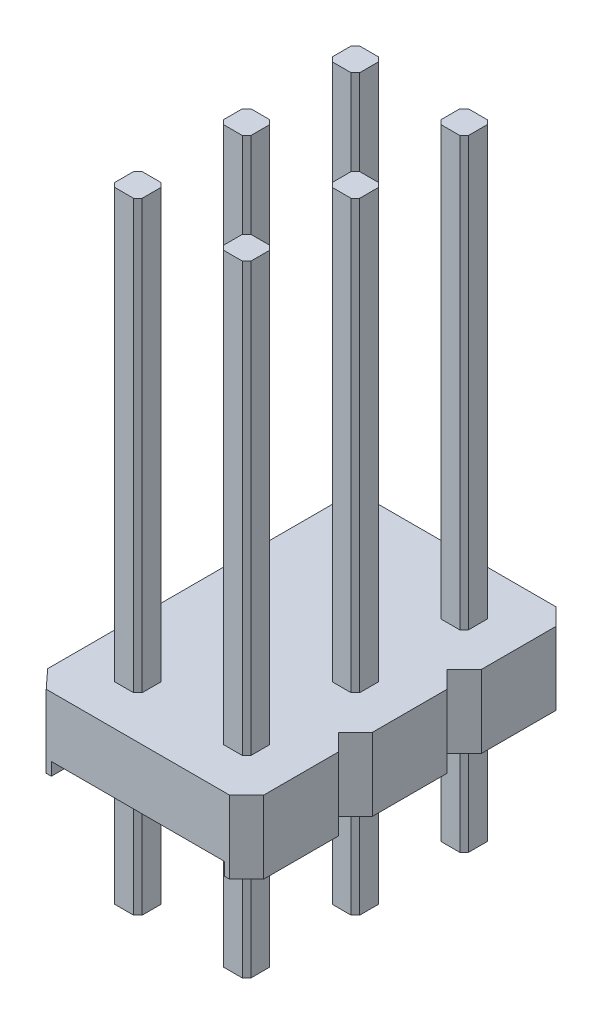
from build123d import *

# Parameters (mm, degrees)
BOSS_EXTRUDE1_DEPTH   = 1.7
SKETCH2_W             = 4.04
SKETCH2_H             = 0.3
CUT_EXTRUDE1_DEPTH    = 2.54
BOSS_EXTRUDE2_START   = -4.5
BOSS_EXTRUDE2_DEPTH   = 14.5
BOSS_EXTRUDE2_2_DEPTH = 14.5
LPATTERN3_START       = -2.8
LPATTERN3_DEPTH       = 14.5
LPATTERN3_2_DEPTH     = 14.5
LPATTERN3_3_DEPTH     = 14.5
LPATTERN3_4_DEPTH     = 14.5
LPATTERN3_START_2     = 0.3
LPATTERN3_5_DEPTH     = 1.4
LPATTERN3_6_DEPTH     = 0.3


# Read off the part's stored shape, not the designer's step: LPattern3
with BuildPart() as part:
    # Sketch1 → Boss-Extrude1 (new body)
    with BuildSketch(Plane(origin=(0, 0, 0), x_dir=(1, 0, 0), z_dir=(0, 1, 0))):
        Polygon((-2.54, 0.903421053), (-2.14, 1.27), (2.14, 1.27), (2.54, 0.87), (2.54, -0.87), (2.14, -1.27), (-2.14, -1.27), (-2.54, -0.836578947), align=None)
    extrude(amount=BOSS_EXTRUDE1_DEPTH)

    # Sketch2 → Cut-Extrude1 (cut)
    with BuildSketch(Plane.XY.offset(1.27)):
        with Locations((0, 0.15)):
            Rectangle(SKETCH2_W, SKETCH2_H)
    extrude(amount=-CUT_EXTRUDE1_DEPTH, mode=Mode.SUBTRACT)

    # LPattern3 5 outline → LPattern3 5 (add)
    with BuildSketch(Plane(origin=(0, 0, 0), x_dir=(1, 0, 0), z_dir=(0, 1, 0)).offset(LPATTERN3_START_2)):
        Polygon((-2.54, 3.443421053), (-2.54, 1.703421053), (-2.14, 1.27), (2.14, 1.27), (2.54, 1.67), (2.54, 3.41), (2.14, 3.81), (2.54, 4.21), (2.54, 5.95), (2.14, 6.35), (-2.14, 6.35), (-2.54, 5.983421053), (-2.54, 4.243421053), (-2.14, 3.81), align=None)
    extrude(amount=LPATTERN3_5_DEPTH)

    # LPattern3 6 outline → LPattern3 6 (add)
    with BuildSketch(Plane(origin=(0, 0, 0), x_dir=(1, 0, 0), z_dir=(0, 1, 0))):
        Polygon((-2.54, 3.443421053), (-2.54, 1.703421053), (-2.14, 1.27), (-2.02, 1.27), (-2.02, 6.35), (-2.14, 6.35), (-2.54, 5.983421053), (-2.54, 4.243421053), (-2.14, 3.81), align=None)
        Polygon((2.02, 6.35), (2.02, 1.27), (2.14, 1.27), (2.54, 1.67), (2.54, 3.41), (2.14, 3.81), (2.54, 4.21), (2.54, 5.95), (2.14, 6.35), align=None)
    extrude(amount=LPATTERN3_6_DEPTH)


with BuildPart() as body_2:
    # Sketch3 → Boss-Extrude2 (new body)
    with BuildSketch(Plane(origin=(0, 1.7, 0), x_dir=(1, 0, 0), z_dir=(0, 1, 0)).offset(BOSS_EXTRUDE2_START)):
        Polygon((-1.49, 0.32), (-1.05, 0.32), (-0.95, 0.22), (-0.95, -0.22), (-1.05, -0.32), (-1.49, -0.32), (-1.59, -0.22), (-1.59, 0.22), align=None)
    extrude(amount=BOSS_EXTRUDE2_DEPTH)


with BuildPart() as body_3:
    # Sketch3 → Boss-Extrude2 2 (new body)
    with BuildSketch(Plane(origin=(0, 1.7, 0), x_dir=(1, 0, 0), z_dir=(0, 1, 0)).offset(BOSS_EXTRUDE2_START)):
        Polygon((1.05, 0.32), (1.49, 0.32), (1.59, 0.22), (1.59, -0.22), (1.49, -0.32), (1.05, -0.32), (0.95, -0.22), (0.95, 0.22), align=None)
    extrude(amount=BOSS_EXTRUDE2_2_DEPTH)


with BuildPart() as body_4:
    # LPattern3 outline → LPattern3 (new body)
    with BuildSketch(Plane(origin=(0, 0, 0), x_dir=(1, 0, 0), z_dir=(0, 1, 0)).offset(LPATTERN3_START)):
        Polygon((0.95, 5.3), (0.95, 4.86), (1.05, 4.76), (1.49, 4.76), (1.59, 4.86), (1.59, 5.3), (1.49, 5.4), (1.05, 5.4), align=None)
    extrude(amount=LPATTERN3_DEPTH)


with BuildPart() as body_5:
    # LPattern3 2 outline → LPattern3 2 (new body)
    with BuildSketch(Plane(origin=(0, 0, 0), x_dir=(1, 0, 0), z_dir=(0, 1, 0)).offset(LPATTERN3_START)):
        Polygon((-1.05, 5.4), (-1.49, 5.4), (-1.59, 5.3), (-1.59, 4.86), (-1.49, 4.76), (-1.05, 4.76), (-0.95, 4.86), (-0.95, 5.3), align=None)
    extrude(amount=LPATTERN3_2_DEPTH)


with BuildPart() as body_6:
    # LPattern3 3 outline → LPattern3 3 (new body)
    with BuildSketch(Plane(origin=(0, 0, 0), x_dir=(1, 0, 0), z_dir=(0, 1, 0)).offset(LPATTERN3_START)):
        Polygon((0.95, 2.76), (0.95, 2.32), (1.05, 2.22), (1.49, 2.22), (1.59, 2.32), (1.59, 2.76), (1.49, 2.86), (1.05, 2.86), align=None)
    extrude(amount=LPATTERN3_3_DEPTH)


with BuildPart() as body_7:
    # LPattern3 4 outline → LPattern3 4 (new body)
    with BuildSketch(Plane(origin=(0, 0, 0), x_dir=(1, 0, 0), z_dir=(0, 1, 0)).offset(LPATTERN3_START)):
        Polygon((-1.05, 2.86), (-1.49, 2.86), (-1.59, 2.76), (-1.59, 2.32), (-1.49, 2.22), (-1.05, 2.22), (-0.95, 2.32), (-0.95, 2.76), align=None)
    extrude(amount=LPATTERN3_4_DEPTH)


solid = Compound([part.part, body_2.part, body_3.part, body_4.part, body_5.part, body_6.part, body_7.part])
